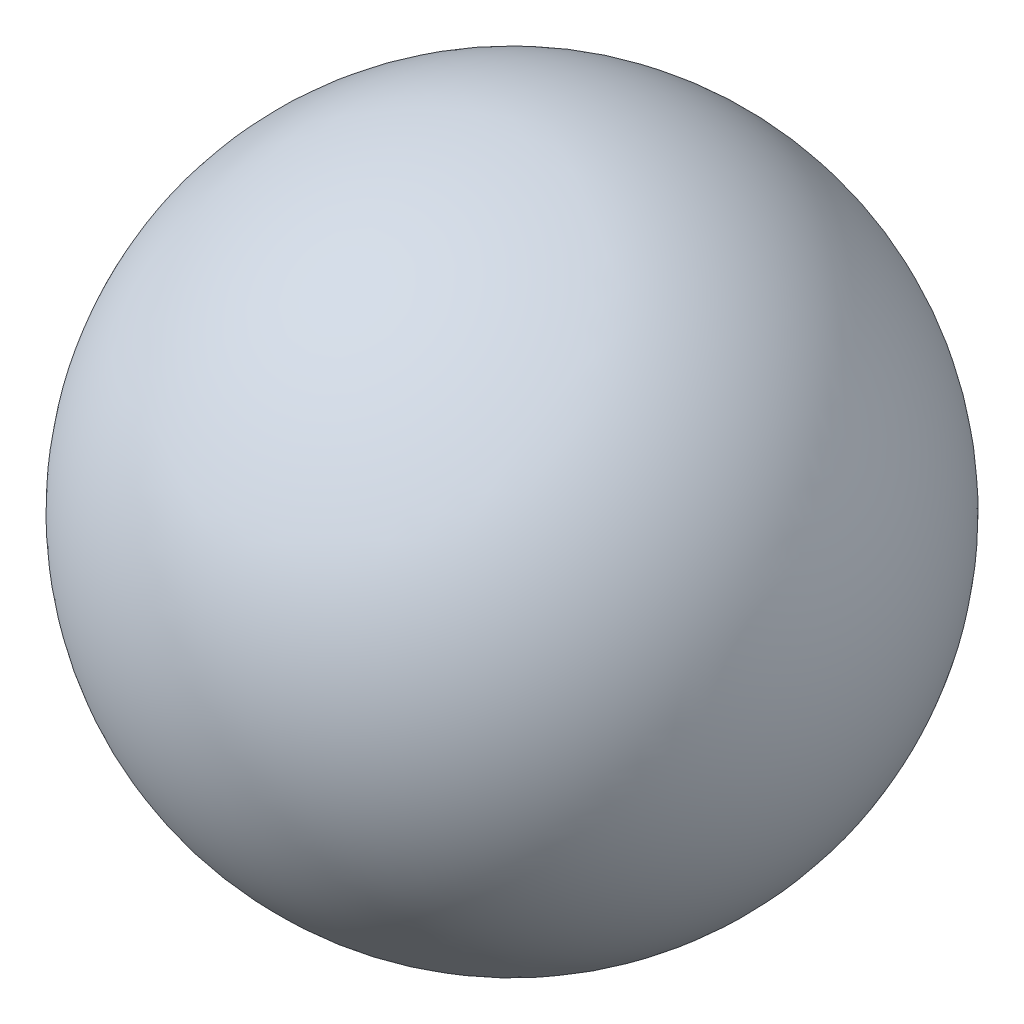
from build123d import *


with BuildPart() as part:
    # Sketch1 → Revolve2 (revolve)
    with BuildSketch(Plane(origin=(0, 0, 0), x_dir=(1, 0, 0), z_dir=(0, 1, 0))):
        with BuildLine():
            Line((10, 0), (-10, 0))
            ThreePointArc((-10, 0), (0, -10), (10, 0))
        make_face()
    revolve(axis=Axis((-10, 0, 0), (1, 0, 0)))


solid = part.part
